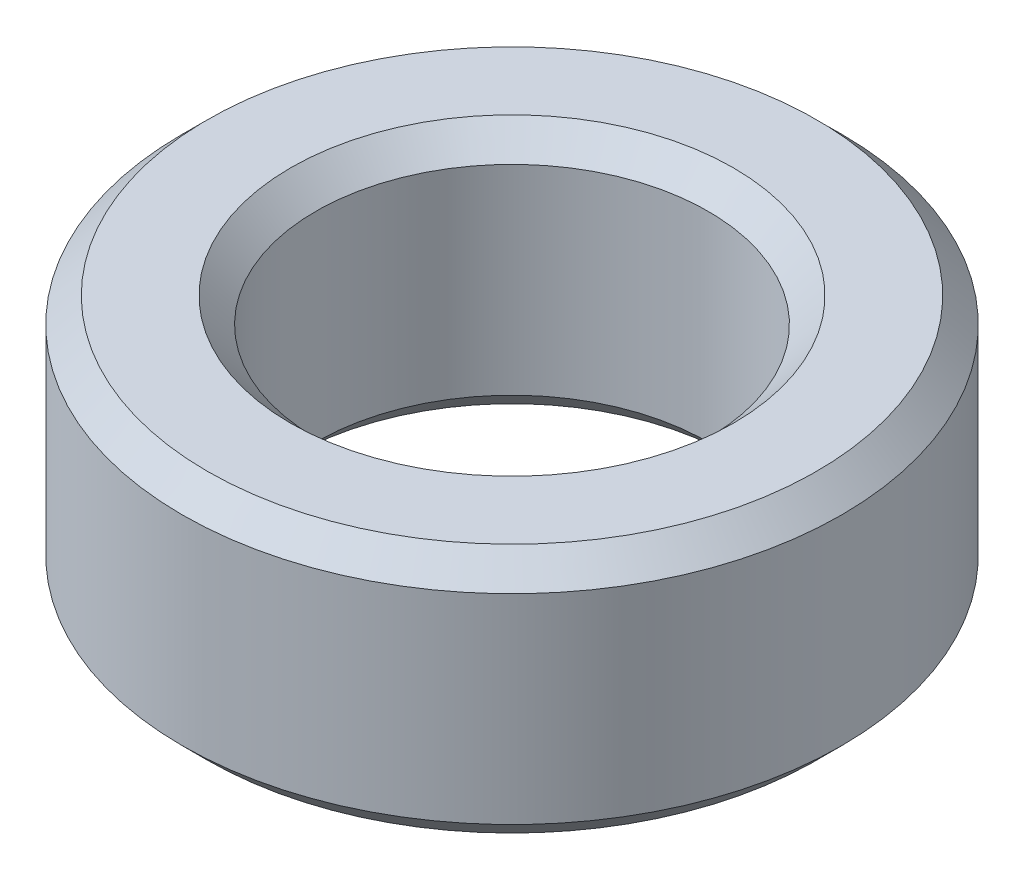
from build123d import *

# Parameters (mm, degrees)
SKETCH1_R           = 27.5
BOSS_EXTRUDE1_DEPTH = 20.865834783
SKETCH2_R           = 16.365064977
CUT_EXTRUDE1_DEPTH  = 45.134828211
CHAMFER1_SIZE       = 2.095834972


with BuildPart() as part:
    # Sketch1 → Boss-Extrude1 (new body)
    with BuildSketch(Plane(origin=(0, 0, 0), x_dir=(1, 0, 0), z_dir=(0, 1, 0))):
        Circle(SKETCH1_R)
    extrude(amount=BOSS_EXTRUDE1_DEPTH)

    # Sketch2 → Cut-Extrude1 (cut, through all)
    with BuildSketch(Plane(origin=(0, 0, 0), x_dir=(1, 0, 0), z_dir=(0, 1, 0))):
        Circle(SKETCH2_R)
    extrude(amount=CUT_EXTRUDE1_DEPTH, mode=Mode.SUBTRACT)

    # Chamfer1
    chamfer1_edges = [part.edges().sort_by_distance(p)[0] for p in [
        (-16.365064977, 20.865834783, 0),
        (-16.365064977, 0, 0),
        (-27.5, 0, 0),
        (-27.5, 20.865834783, 0),
    ]]
    chamfer(chamfer1_edges, length=CHAMFER1_SIZE)


solid = part.part
